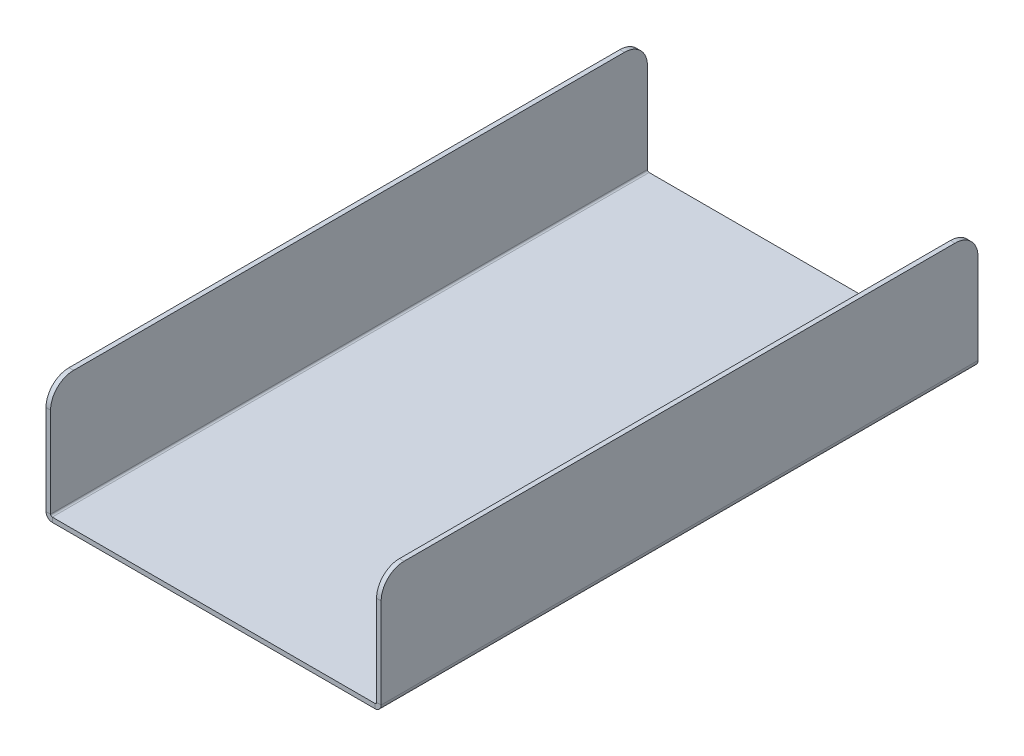
from build123d import *

# Parameters (mm, degrees)
BASIS_BLECH1_DEPTH = 260
VERRUNDUNG1_R      = 10


# Sheet-metal steps are written as plain solids
with BuildPart() as part:
    # Skizze1 → Basis-Blech1 (new body)
    with BuildSketch(Plane.XY):
        with BuildLine():
            Line((-142, 50), (-142, 0.7366))
            ThreePointArc((-142, 0.7366), (-141.784254855, 0.215745145), (-141.2634, 0))
            Line((-141.2634, 0), (-0.7366, 0))
            ThreePointArc((-0.7366, 0), (-0.215745145, 0.215745145), (0, 0.7366))
            Line((0, 0.7366), (0, 50))
            Line((0, 50), (2, 50))
            Line((2, 50), (2, 0.7366))
            ThreePointArc((2, 0.7366), (1.198468417, -1.198468417), (-0.7366, -2))
            Line((-0.7366, -2), (-141.2634, -2))
            ThreePointArc((-141.2634, -2), (-143.198468417, -1.198468417), (-144, 0.7366))
            Line((-144, 0.7366), (-144, 50))
            Line((-144, 50), (-142, 50))
        make_face()
    extrude(amount=BASIS_BLECH1_DEPTH)

    # Verrundung1
    verrundung1_edges = [part.edges().sort_by_distance(p)[0] for p in [
        (-143, 50, 0),
        (1, 50, 0),
        (-143, 50, 260),
        (1, 50, 260),
    ]]
    fillet(verrundung1_edges, radius=VERRUNDUNG1_R)


solid = part.part
